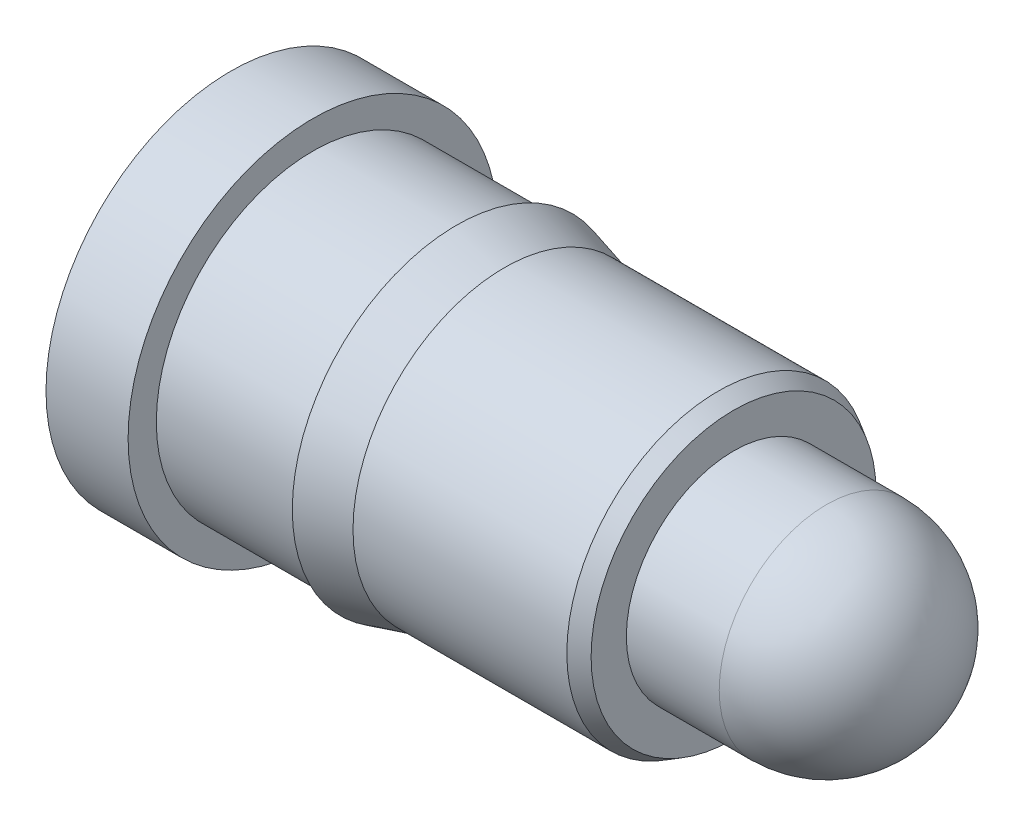
from build123d import *

# Parameters (mm, degrees)
CHAMFER1_SIZE  = 0.043994091
CHAMFER1_SIZE2 = 0.0762


# Read off the part's stored shape, not the designer's step: Boss-Extrude1
with BuildPart() as part:
    # Sketch1 → Revolve1 (revolve)
    with BuildSketch(Plane(origin=(0, 0, 0), x_dir=(-1, 0, 0), z_dir=(0, 0, -1)), mode=Mode.PRIVATE) as revolve1_sk:
        Polygon((-2.4892, 0.7493), (-2.4892, 0), (0, 0), (0, 0.9144), (-0.4064, 0.9144), (-0.4064, 0.7747), (-1.1176, 0.7747), (-1.1176, 0.8128), (-1.354585226, 0.7493), align=None)
    revolve(revolve1_sk.sketch.rotate(Axis((2.4892, 0, 0), (-1, 0, 0)), 270), axis=Axis((2.4892, 0, 0), (-1, 0, 0)))

    # Boss-Extrude1 outline → Boss-Extrude1 (revolve)
    with BuildSketch(Plane.YX):
        with BuildLine():
            Line((0.53086, 2.4892), (0.53086, 2.948939999))
            ThreePointArc((0.53086, 2.948939999), (0.375374706, 3.324314706), (0, 3.4798))
            Line((0, 3.4798), (0, 2.4892))
            Line((0, 2.4892), (0.53086, 2.4892))
        make_face()
    revolve(axis=Axis((0, 0, 0), (1, 0, 0)))

    # Chamfer1
    chamfer1_edges = [part.edges().sort_by_distance(p)[0] for p in [
        (2.4892, 0, -0.7493),
    ]]
    chamfer1_side = [part.faces().sort_by_distance(p)[0] for p in [
        (2.4892, 0, -0.728106596),
    ]]
    chamfer(chamfer1_edges, length=CHAMFER1_SIZE, length2=CHAMFER1_SIZE2, reference=chamfer1_side[0])


solid = part.part
